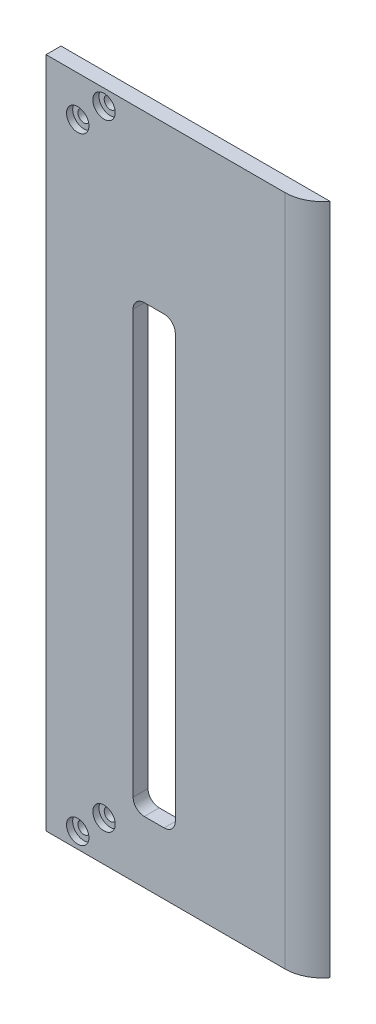
from build123d import *

# Parameters (mm, degrees)
CROQUIS1_W              = 72
CROQUIS1_H              = 180
CROQUIS1_R              = 1.6
SALIENTE_EXTRUIR1_DEPTH = 4
CROQUIS2_R              = 3
CORTAR_EXTRUIR1_DEPTH   = 1.65
CROQUIS3_W              = 5
CROQUIS3_H              = 10
SALIENTE_EXTRUIR2_DEPTH = 10
CORTAR_EXTRUIR2_REACH   = 263.951
CROQUIS4_R              = 1.5
CROQUIS4_3_R            = 1.5
CORTAR_EXTRUIR3_DEPTH   = 1.65
REDONDEO2_R             = 10
CORTAR_EXTRUIR4_REACH   = 262.458
CROQUIS6_W              = 11.3
CROQUIS6_H              = 119.12
CORTAR_EXTRUIR5_DEPTH   = 4
REDONDEO3_R             = 3


with BuildPart() as part:
    # Croquis1 → Saliente-Extruir1 (new body)
    with BuildSketch(Plane.XY):
        with Locations((26, 162.773389683)):
            Rectangle(CROQUIS1_W, CROQUIS1_H)
        with Locations((-1.52, 76.973389683)):
            Circle(CROQUIS1_R, mode=Mode.SUBTRACT)
        with Locations((5.52, 83.573389683)):
            Circle(CROQUIS1_R, mode=Mode.SUBTRACT)
        with Locations((-1.52, 241.973389683)):
            Circle(CROQUIS1_R, mode=Mode.SUBTRACT)
        with Locations((5.52, 248.573389683)):
            Circle(CROQUIS1_R, mode=Mode.SUBTRACT)
    extrude(amount=SALIENTE_EXTRUIR1_DEPTH)

    # Croquis2 → Cortar-Extruir1 (cut)
    with BuildSketch(Plane.XY.offset(4)):
        with Locations((-1.52, 76.973389683)):
            Circle(CROQUIS2_R)
        with Locations((5.52, 83.573389683)):
            Circle(CROQUIS2_R)
        with Locations((-1.52, 241.973389683)):
            Circle(CROQUIS2_R)
        with Locations((5.52, 248.573389683)):
            Circle(CROQUIS2_R)
    extrude(amount=-CORTAR_EXTRUIR1_DEPTH, mode=Mode.SUBTRACT)

    # Croquis3 → Saliente-Extruir2 (add)
    with BuildSketch(Plane(origin=(0, 0, 0), x_dir=(-1, 0, 0), z_dir=(0, 0, -1))):
        with Locations((3.5, 125.273389683)):
            Rectangle(CROQUIS3_W, CROQUIS3_H)
        with Locations((3.5, 200.273389683)):
            Rectangle(CROQUIS3_W, CROQUIS3_H)
    extrude(amount=SALIENTE_EXTRUIR2_DEPTH)

    # Croquis4 → Cortar-Extruir2 (cut, up to next)
    with BuildSketch(Plane.ZY.offset(6), mode=Mode.PRIVATE) as cortar_extruir2_sk1:
        with Locations(Location((-5, 125.273389683, 0), (0, 0, 270))):
            Circle(CROQUIS4_R)
    cortar_extruir2_tool1 = extrude(cortar_extruir2_sk1.sketch, amount=-CORTAR_EXTRUIR2_REACH, mode=Mode.PRIVATE) & part.part
    # Croquis4 → Cortar-Extruir2 (cut, up to next)
    with BuildSketch(Plane.ZY.offset(6), mode=Mode.PRIVATE) as cortar_extruir2_sk2:
        with Locations(Location((-5, 200.273389683, 0), (0, 0, 270))):
            Circle(CROQUIS4_R)
    cortar_extruir2_tool2 = extrude(cortar_extruir2_sk2.sketch, amount=-CORTAR_EXTRUIR2_REACH, mode=Mode.PRIVATE) & part.part
    add(cortar_extruir2_tool1.solids().sort_by_distance((-6, 125.27339, -5))[0], mode=Mode.SUBTRACT)
    add(cortar_extruir2_tool2.solids().sort_by_distance((-6, 200.27339, -5))[0], mode=Mode.SUBTRACT)

    # Croquis4<3> → Cortar-Extruir3 (cut)
    # profile 1 of 2: a face of its own
    with BuildSketch(Plane.ZY.offset(6)):
        Polygon((-8.175426481, 200.273389683), (-6.58771324, 197.523389683), (-3.41228676, 197.523389683), (-1.824573519, 200.273389683), (-3.41228676, 203.023389683), (-6.58771324, 203.023389683), align=None)
        with Locations(Location((-5, 200.273389683, 0), (0, 0, 270))):
            Circle(CROQUIS4_3_R, mode=Mode.SUBTRACT)
    # profile 2 of 2: a face of its own
    with BuildSketch(Plane.ZY.offset(6)):
        Polygon((-8.175426481, 125.273389683), (-6.58771324, 122.523389683), (-3.41228676, 122.523389683), (-1.824573519, 125.273389683), (-3.41228676, 128.023389683), (-6.58771324, 128.023389683), align=None)
        with Locations(Location((-5, 125.273389683, 0), (0, 0, 270))):
            Circle(CROQUIS4_3_R, mode=Mode.SUBTRACT)
    extrude(amount=-CORTAR_EXTRUIR3_DEPTH, mode=Mode.SUBTRACT)

    # Redondeo2
    # the kernel refuses this fillet: 10 mm, written as the material it takes off along each edge
    with BuildSketch(Plane(origin=(62, 52.773389683, 4), x_dir=(0, 0, -1), z_dir=(0, 1, 0))) as redondeo2_piece_1:
        with BuildLine():
            CenterArc((10, 8), REDONDEO2_R, 180, 53.130102354)
            Line((0, 8), (-0.2, 8))
            Line((-0.2, 8), (-0.2, 0))
            Line((-0.2, 0), (0, -0.2))
            ThreePointArc((0, -0.2), (2, -0.2), (3.88, -0.16))
            Line((3.88, -0.16), (4, 0))
        make_face()
    extrude(amount=220, mode=Mode.SUBTRACT)

    # Croquis5 → Cortar-Extruir4 (cut, up to next)
    with BuildSketch(Plane(origin=(0, 0, 0), x_dir=(-1, 0, 0), z_dir=(0, 0, -1)), mode=Mode.PRIVATE) as cortar_extruir4_sk1:
        with BuildLine():
            Line((-18.04, 177.143389683), (-18.04, 170.803389683))
            ThreePointArc((-18.04, 170.803389683), (-18.479339828, 169.742729511), (-19.54, 169.303389683))
            Line((-19.54, 169.303389683), (-20.1, 169.303389683))
            ThreePointArc((-20.1, 169.303389683), (-21.160660172, 169.742729511), (-21.6, 170.803389683))
            Line((-21.6, 170.803389683), (-21.6, 177.143389683))
            ThreePointArc((-21.6, 177.143389683), (-21.160660172, 178.204049855), (-20.1, 178.643389683))
            Line((-20.1, 178.643389683), (-19.54, 178.643389683))
            ThreePointArc((-19.54, 178.643389683), (-18.479339828, 178.204049855), (-18.04, 177.143389683))
        make_face()
    cortar_extruir4_tool1 = extrude(cortar_extruir4_sk1.sketch, amount=-CORTAR_EXTRUIR4_REACH, mode=Mode.PRIVATE) & part.part
    # Croquis5 → Cortar-Extruir4 (cut, up to next)
    with BuildSketch(Plane(origin=(0, 0, 0), x_dir=(-1, 0, 0), z_dir=(0, 0, -1)), mode=Mode.PRIVATE) as cortar_extruir4_sk2:
        with BuildLine():
            Line((-18.3, 191.373389683), (-18.3, 185.773389683))
            ThreePointArc((-18.3, 185.773389683), (-18.490380592, 185.313770275), (-18.95, 185.123389683))
            Line((-18.95, 185.123389683), (-20.27019783, 185.123389683))
            ThreePointArc((-20.27019783, 185.123389683), (-20.510915139, 185.169605635), (-20.717401742, 185.301681447))
            Line((-20.717401742, 185.301681447), (-21.397203913, 185.946169218))
            ThreePointArc((-21.397203913, 185.946169218), (-21.547152637, 186.161150502), (-21.6, 186.417877455))
            Line((-21.6, 186.417877455), (-21.6, 188.413389575))
            Line((-21.6, 188.413389575), (-21.6, 190.728901911))
            ThreePointArc((-21.6, 190.728901911), (-21.547152637, 190.985628864), (-21.397203913, 191.200610148))
            Line((-21.397203913, 191.200610148), (-20.717401742, 191.84509792))
            ThreePointArc((-20.717401742, 191.84509792), (-20.510915139, 191.977173731), (-20.27019783, 192.023389683))
            Line((-20.27019783, 192.023389683), (-18.95, 192.023389683))
            ThreePointArc((-18.95, 192.023389683), (-18.490380592, 191.833009091), (-18.3, 191.373389683))
        make_face()
    cortar_extruir4_tool2 = extrude(cortar_extruir4_sk2.sketch, amount=-CORTAR_EXTRUIR4_REACH, mode=Mode.PRIVATE) & part.part
    # Croquis5 → Cortar-Extruir4 (cut, up to next)
    with BuildSketch(Plane(origin=(0, 0, 0), x_dir=(-1, 0, 0), z_dir=(0, 0, -1)), mode=Mode.PRIVATE) as cortar_extruir4_sk3:
        with BuildLine():
            Line((-18.95, 198.523389683), (-20.27019783, 198.523389683))
            ThreePointArc((-20.27019783, 198.523389683), (-20.510915139, 198.569605635), (-20.717401742, 198.701681447))
            Line((-20.717401742, 198.701681447), (-21.397203913, 199.346169218))
            ThreePointArc((-21.397203913, 199.346169218), (-21.547152637, 199.561150502), (-21.6, 199.817877455))
            Line((-21.6, 199.817877455), (-21.6, 201.813389575))
            Line((-21.6, 201.813389575), (-21.6, 204.128901911))
            ThreePointArc((-21.6, 204.128901911), (-21.547152637, 204.385628864), (-21.397203913, 204.600610148))
            Line((-21.397203913, 204.600610148), (-20.717401742, 205.24509792))
            ThreePointArc((-20.717401742, 205.24509792), (-20.510915139, 205.377173731), (-20.27019783, 205.423389683))
            Line((-20.27019783, 205.423389683), (-18.95, 205.423389683))
            ThreePointArc((-18.95, 205.423389683), (-18.490380592, 205.233009091), (-18.3, 204.773389683))
            Line((-18.3, 204.773389683), (-18.3, 199.173389683))
            ThreePointArc((-18.3, 199.173389683), (-18.490380592, 198.713770275), (-18.95, 198.523389683))
        make_face()
    cortar_extruir4_tool3 = extrude(cortar_extruir4_sk3.sketch, amount=-CORTAR_EXTRUIR4_REACH, mode=Mode.PRIVATE) & part.part
    add(cortar_extruir4_tool1.solids().sort_by_distance((19.82, 173.97339, 0))[0], mode=Mode.SUBTRACT)
    add(cortar_extruir4_tool2.solids().sort_by_distance((19.895302, 188.57339, 0))[0], mode=Mode.SUBTRACT)
    add(cortar_extruir4_tool3.solids().sort_by_distance((19.895302, 201.97339, 0))[0], mode=Mode.SUBTRACT)

    # Croquis6 → Cortar-Extruir5 (cut)
    with BuildSketch(Plane.XY.offset(4)):
        with Locations((18.95, 148.863389683)):
            Rectangle(CROQUIS6_W, CROQUIS6_H)
    extrude(amount=-CORTAR_EXTRUIR5_DEPTH, mode=Mode.SUBTRACT)

    # Redondeo3
    redondeo3_edges = [part.edges().sort_by_distance(p)[0] for p in [
        (13.3, 89.303389683, 2),
        (13.3, 208.423389683, 2),
        (24.6, 208.423389683, 2),
        (24.6, 89.303389683, 2),
    ]]
    fillet(redondeo3_edges, radius=REDONDEO3_R)


solid = part.part
